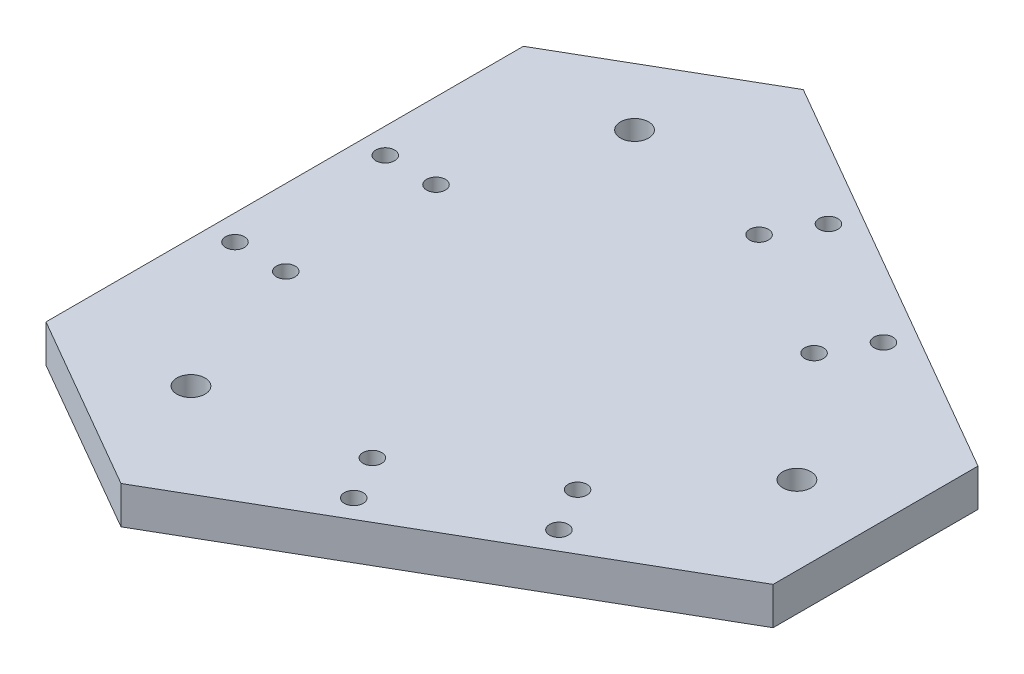
from build123d import *

# Parameters (mm, degrees)
BOSS_EXTRUDE1_DEPTH = 12.7
SKETCH3_R           = 3.175
SKETCH3_R_2         = 4.7625
CUT_EXTRUDE1_DEPTH  = 20.32


with BuildPart() as part:
    # Sketch2 → Boss-Extrude1 (new body)
    with BuildSketch(Plane(origin=(0, 0, 0), x_dir=(1, 0, 0), z_dir=(0, 1, 0))):
        Polygon((-26.602540378, 115.358983849), (-86.602540378, 80.717967697), (-86.602540378, -80.717967697), (-26.602540378, -115.358983849), (113.205080757, -34.641016151), (113.205080757, 34.641016151), align=None)
    extrude(amount=BOSS_EXTRUDE1_DEPTH)

    # Sketch3 → Cut-Extrude1 (cut)
    with BuildSketch(Plane.XZ):
        with Locations((-78.014165378, -25.4)):
            Circle(SKETCH3_R)
        with Locations((-60.837415378, -25.4)):
            Circle(SKETCH3_R)
        with Locations((-78.014165378, 25.4)):
            Circle(SKETCH3_R)
        with Locations((-60.837415378, 25.4)):
            Circle(SKETCH3_R)
        with Locations((61.004127945, 54.862249073)):
            Circle(SKETCH3_R)
        with Locations((17.010037433, 80.262249073)):
            Circle(SKETCH3_R)
        with Locations((52.415752945, 39.986747218)):
            Circle(SKETCH3_R)
        with Locations((8.421662433, 65.386747218)):
            Circle(SKETCH3_R)
        with Locations((8.421662433, -65.386747218)):
            Circle(SKETCH3_R)
        with Locations((17.010037433, -80.262249073)):
            Circle(SKETCH3_R)
        with Locations((61.004127945, -54.862249073)):
            Circle(SKETCH3_R)
        with Locations((52.415752945, -39.986747218)):
            Circle(SKETCH3_R)
        with Locations((86.602540378, 0)):
            Circle(SKETCH3_R_2)
        with Locations((-43.301270189, 75)):
            Circle(SKETCH3_R_2)
        with Locations((-43.301270189, -75)):
            Circle(SKETCH3_R_2)
    extrude(amount=-CUT_EXTRUDE1_DEPTH, mode=Mode.SUBTRACT)


solid = part.part
